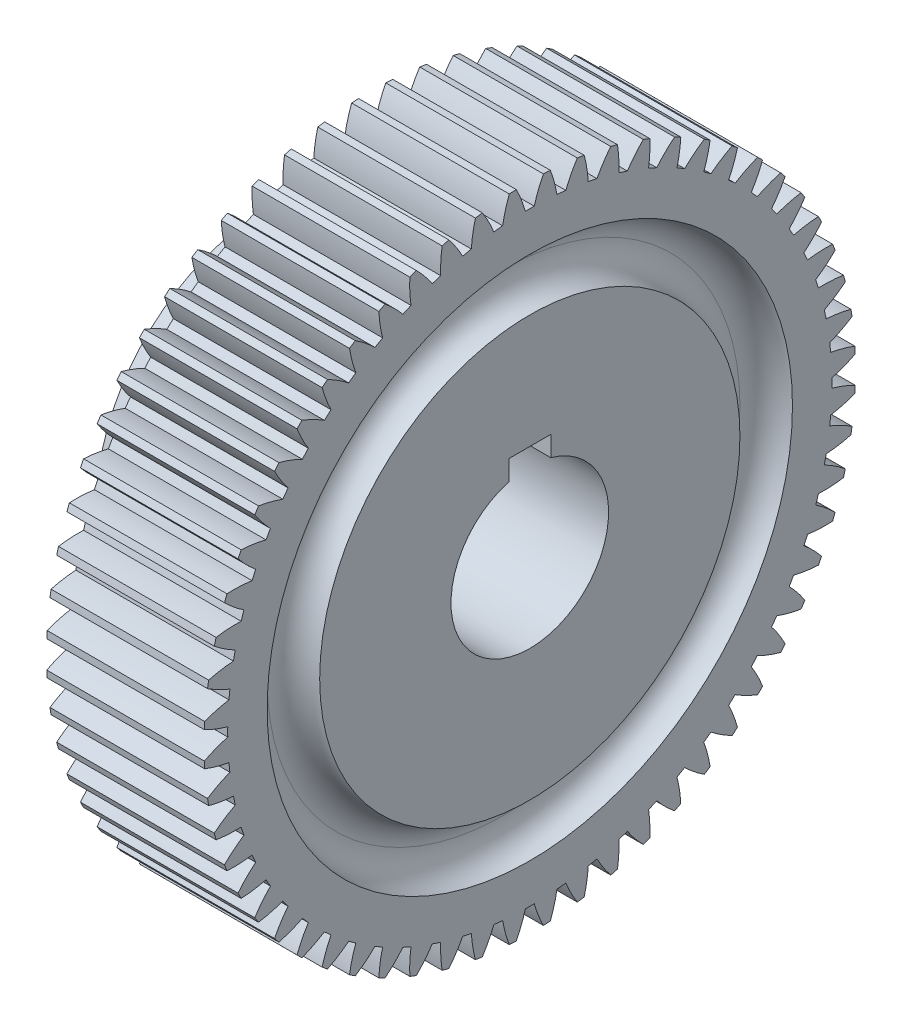
from build123d import *

# Parameters (mm, degrees)
FILLET1_START       = -9.108678671
FILLET1_DEPTH       = 30
FILLET1_START_2     = -29.108729471
FILLET1_2_OUTLINE_R = 32.5
FILLET1_2_DEPTH     = 20.0000508
SKETCH3_R           = 50
SKETCH3_R_2         = 40
CUT_EXTRUDE1_DEPTH  = 5
FILLET2_R           = 5
CUT_EXTRUDE2_START  = -5
SKETCH4_R           = 50
SKETCH4_R_2         = 40
CUT_EXTRUDE2_DEPTH  = 5
FILLET3_R           = 5


with BuildPart() as part:
    # Fillet1: read off the stored shape, not the designer's step
    # Fillet1 outline → Fillet1 (new body)
    with BuildSketch(Plane.YZ.offset(FILLET1_START)):
        with BuildLine():
            ThreePointArc((8.778409007, 60.022111997), (8.117564512, 60.060283888), (7.456350143, 60.091398166))
            ThreePointArc((7.456350143, 60.091398166), (6.476126837, 57.908102067), (5.718221378, 55.63803623))
            ThreePointArc((5.718221378, 55.63803623), (4.872735225, 55.644252733), (4.027249072, 55.63803623))
            ThreePointArc((4.027249072, 55.63803623), (3.269343613, 57.908102067), (2.289120307, 60.091398166))
            ThreePointArc((2.289120307, 60.091398166), (1.627905938, 60.060283888), (0.967061442, 60.022111997))
            ThreePointArc((0.967061442, 60.022111997), (0.220424489, 57.748314986), (-0.296042591, 55.411462115))
            ThreePointArc((-0.296042591, 55.411462115), (-1.137546885, 55.329267195), (-1.977751575, 55.234707378))
            ThreePointArc((-1.977751575, 55.234707378), (-2.968791642, 57.413114863), (-4.171861767, 59.481989403))
            ThreePointArc((-4.171861767, 59.481989403), (-4.826201608, 59.38192985), (-5.479435879, 59.274890009))
            ThreePointArc((-5.479435879, 59.274890009), (-5.984306169, 56.935504283), (-6.253676349, 54.557467426))
            ThreePointArc((-6.253676349, 54.557467426), (-7.081979085, 54.387761628), (-7.907696854, 54.205894514))
            ThreePointArc((-7.907696854, 54.205894514), (-9.121013487, 56.26877656), (-10.533749345, 58.200562517))
            ThreePointArc((-10.533749345, 58.200562517), (-11.174045572, 58.032653963), (-11.812512647, 57.857918923))
            ThreePointArc((-11.812512647, 57.857918923), (-12.07008481, 55.47857528), (-12.089406814, 53.085408707))
            ThreePointArc((-12.089406814, 53.085408707), (-12.895432935, 52.830051364), (-13.697617045, 52.562869528))
            ThreePointArc((-13.697617045, 52.562869528), (-15.119916892, 54.487624767), (-16.726840253, 56.26115709))
            ThreePointArc((-16.726840253, 56.26115709), (-17.346077647, 56.027239176), (-17.962782347, 55.78672337))
            ThreePointArc((-17.962782347, 55.78672337), (-17.970234369, 53.393490399), (-17.739296501, 51.011414144))
            ThreePointArc((-17.739296501, 51.011414144), (-18.514215015, 50.673203002), (-19.28407657, 50.323633744))
            ThreePointArc((-19.28407657, 50.323633744), (-20.899776618, 52.089174155), (-22.683281692, 53.685021653))
            ThreePointArc((-22.683281692, 53.685021653), (-23.274675759, 53.387657233), (-23.862861339, 53.083995803))
            ThreePointArc((-23.862861339, 53.083995803), (-23.620111573, 50.703094264), (-23.141444036, 48.358206852))
            ThreePointArc((-23.141444036, 48.358206852), (-23.876764775, 47.940847426), (-24.605869011, 47.512720699))
            ThreePointArc((-24.605869011, 47.512720699), (-26.39726731, 49.099702652), (-28.337813644, 50.500380886))
            ThreePointArc((-28.337813644, 50.500380886), (-28.894884946, 50.142827946), (-29.448107121, 49.779347871))
            ThreePointArc((-29.448107121, 49.779347871), (-28.957815185, 47.43686342), (-28.236662361, 45.154855928))
            ThreePointArc((-28.236662361, 45.154855928), (-28.924328997, 44.662920893), (-29.604687694, 44.160927344))
            ThreePointArc((-29.604687694, 44.160927344), (-31.552157311, 45.551963533), (-33.628483872, 46.742126378))
            ThreePointArc((-33.628483872, 46.742126378), (-34.14512902, 46.328302344), (-34.657326573, 45.908985986))
            ThreePointArc((-34.657326573, 45.908985986), (-33.924864207, 43.630583372), (-32.969127197, 41.436457953))
            ThreePointArc((-32.969127197, 41.436457953), (-33.60160551, 40.875337053), (-34.225764517, 40.304976629))
            ThreePointArc((-34.225764517, 40.304976629), (-36.307968567, 41.484826569), (-38.497326687, 42.451434353))
            ThreePointArc((-38.497326687, 42.451434353), (-38.967885209, 41.985873167), (-39.433446395, 41.515314645))
            ThreePointArc((-39.433446395, 41.515314645), (-38.466838611, 39.325956525), (-37.28698867, 37.243752475))
            ThreePointArc((-37.28698867, 37.243752475), (-37.857349095, 36.619593468), (-38.418469995, 35.987115156))
            ThreePointArc((-38.418469995, 35.987115156), (-40.612595414, 36.942852165), (-42.890998028, 37.675314531))
            ThreePointArc((-42.890998028, 37.675314531), (-43.310314385, 37.163116978), (-43.72413842, 36.64647183))
            ThreePointArc((-43.72413842, 36.64647183), (-42.533975574, 34.570145269), (-41.142939386, 32.622675652))
            ThreePointArc((-41.142939386, 32.622675652), (-41.644932935, 31.942316955), (-42.13686797, 31.254650319))
            ThreePointArc((-42.13686797, 31.254650319), (-44.418875461, 31.975803143), (-46.761359912, 32.46609508))
            ThreePointArc((-46.761359912, 32.46609508), (-47.124839988, 31.912872905), (-47.482392927, 31.355801602))
            ThreePointArc((-47.482392927, 31.355801602), (-46.081714694, 29.415255268), (-44.494732741, 27.623856969))
            ThreePointArc((-44.494732741, 27.623856969), (-44.922859467, 26.894752733), (-45.340218894, 26.159431994))
            ThreePointArc((-45.340218894, 26.159431994), (-47.685106306, 26.638099531), (-50.066007845, 26.880849297))
            ThreePointArc((-50.066007845, 26.880849297), (-50.369669275, 26.292663717), (-50.667033695, 25.701269651))
            ThreePointArc((-50.667033695, 25.701269651), (-49.071186197, 23.917764576), (-47.305645786, 22.302064529))
            ThreePointArc((-47.305645786, 22.302064529), (-47.655215044, 21.532202974), (-47.993426185, 20.757284459))
            ThreePointArc((-47.993426185, 20.757284459), (-50.375502441, 20.988222327), (-52.768735412, 20.980770306))
            ThreePointArc((-52.768735412, 20.980770306), (-53.009251218, 20.364065605), (-53.243169132, 19.744828211))
            ThreePointArc((-53.243169132, 19.744828211), (-51.469636809, 18.137904851), (-49.544881569, 16.715605003))
            ThreePointArc((-49.544881569, 16.715605003), (-49.812063406, 15.913420893), (-50.067420749, 15.107394772))
            ThreePointArc((-50.067420749, 15.107394772), (-52.460587322, 15.088072768), (-54.839930965, 14.830500605))
            ThreePointArc((-54.839930965, 14.830500605), (-55.014666005, 14.19203353), (-55.182574559, 13.551737303))
            ThreePointArc((-55.182574559, 13.551737303), (-53.250788602, 12.139001445), (-51.187906556, 10.925684812))
            ThreePointArc((-51.187906556, 10.925684812), (-51.36977367, 10.099967044), (-51.539479467, 9.271664308))
            ThreePointArc((-51.539479467, 9.271664308), (-53.917516324, 9.002294128), (-56.256902051, 8.497423837))
            ThreePointArc((-56.256902051, 8.497423837), (-56.363941892, 7.844189566), (-56.464001444, 7.189849726))
            ThreePointArc((-56.464001444, 7.189849726), (-54.395126905, 5.9867796), (-52.21671942, 4.995739533))
            ThreePointArc((-52.21671942, 4.995739533), (-52.311279237, 4.155534843), (-52.393474156, 3.314030549))
            ThreePointArc((-52.393474156, 3.314030549), (-54.730327027, 2.797563469), (-57.004124038, 2.050926516))
            ThreePointArc((-57.004124038, 2.050926516), (-57.04229593, 1.39008202), (-57.073410208, 0.728867651))
            ThreePointArc((-57.073410208, 0.728867651), (-54.890114108, -0.251355654), (-52.620048271, -1.009261113))
            ThreePointArc((-52.620048271, -1.009261113), (-52.626264775, -1.854747266), (-52.620048271, -2.70023342))
            ThreePointArc((-52.620048271, -2.70023342), (-54.890114108, -3.458138879), (-57.073410208, -4.438362184))
            ThreePointArc((-57.073410208, -4.438362184), (-57.04229593, -5.099576553), (-57.004124038, -5.760421049))
            ThreePointArc((-57.004124038, -5.760421049), (-54.730327027, -6.507058003), (-52.393474156, -7.023525083))
            ThreePointArc((-52.393474156, -7.023525083), (-52.311279237, -7.865029376), (-52.21671942, -8.705234066))
            ThreePointArc((-52.21671942, -8.705234066), (-54.395126905, -9.696274133), (-56.464001444, -10.899344259))
            ThreePointArc((-56.464001444, -10.899344259), (-56.363941892, -11.553684099), (-56.256902051, -12.20691837))
            ThreePointArc((-56.256902051, -12.20691837), (-53.917516324, -12.711788661), (-51.539479467, -12.981158841))
            ThreePointArc((-51.539479467, -12.981158841), (-51.36977367, -13.809461577), (-51.187906556, -14.635179346))
            ThreePointArc((-51.187906556, -14.635179346), (-53.250788602, -15.848495978), (-55.182574559, -17.261231836))
            ThreePointArc((-55.182574559, -17.261231836), (-55.014666005, -17.901528063), (-54.839930965, -18.539995138))
            ThreePointArc((-54.839930965, -18.539995138), (-52.460587323, -18.797567302), (-50.067420749, -18.816889305))
            ThreePointArc((-50.067420749, -18.816889305), (-49.812063406, -19.622915426), (-49.544881569, -20.425099537))
            ThreePointArc((-49.544881569, -20.425099537), (-51.469636809, -21.847399384), (-53.243169132, -23.454322744))
            ThreePointArc((-53.243169132, -23.454322744), (-53.009251218, -24.073560138), (-52.768735412, -24.690264839))
            ThreePointArc((-52.768735412, -24.690264839), (-50.375502441, -24.697716861), (-47.993426185, -24.466778992))
            ThreePointArc((-47.993426185, -24.466778992), (-47.655215044, -25.241697507), (-47.305645786, -26.011559062))
            ThreePointArc((-47.305645786, -26.011559062), (-49.071186197, -27.627259109), (-50.667033695, -29.410764184))
            ThreePointArc((-50.667033695, -29.410764184), (-50.369669275, -30.002158251), (-50.066007845, -30.590343831))
            ThreePointArc((-50.066007845, -30.590343831), (-47.685106306, -30.347594065), (-45.340218894, -29.868926527))
            ThreePointArc((-45.340218894, -29.868926527), (-44.922859467, -30.604247266), (-44.494732741, -31.333351502))
            ThreePointArc((-44.494732741, -31.333351502), (-46.081714694, -33.124749802), (-47.482392927, -35.065296135))
            ThreePointArc((-47.482392927, -35.065296135), (-47.124839988, -35.622367438), (-46.761359912, -36.175589613))
            ThreePointArc((-46.761359912, -36.175589613), (-44.418875461, -35.685297676), (-42.13686797, -34.964144852))
            ThreePointArc((-42.13686797, -34.964144852), (-41.644932935, -35.651811488), (-41.142939386, -36.332170186))
            ThreePointArc((-41.142939386, -36.332170186), (-42.533975574, -38.279639803), (-43.72413842, -40.355966364))
            ThreePointArc((-43.72413842, -40.355966364), (-43.310314385, -40.872611512), (-42.890998028, -41.384809064))
            ThreePointArc((-42.890998028, -41.384809064), (-40.612595414, -40.652346699), (-38.418469995, -39.696609689))
            ThreePointArc((-38.418469995, -39.696609689), (-37.857349095, -40.329088002), (-37.28698867, -40.953247009))
            ThreePointArc((-37.28698867, -40.953247009), (-38.466838611, -43.035451058), (-39.433446395, -45.224809179))
            ThreePointArc((-39.433446395, -45.224809179), (-38.967885209, -45.695367701), (-38.497326687, -46.160928887))
            ThreePointArc((-38.497326687, -46.160928887), (-36.307968567, -45.194321102), (-34.225764517, -44.014471162))
            ThreePointArc((-34.225764517, -44.014471162), (-33.60160551, -44.584831587), (-32.969127197, -45.145952487))
            ThreePointArc((-32.969127197, -45.145952487), (-33.924864207, -47.340077906), (-34.657326573, -49.61848052))
            ThreePointArc((-34.657326573, -49.61848052), (-34.14512902, -50.037796877), (-33.628483872, -50.451620911))
            ThreePointArc((-33.628483872, -50.451620911), (-31.552157311, -49.261458066), (-29.604687694, -47.870421877))
            ThreePointArc((-29.604687694, -47.870421877), (-28.924328997, -48.372415426), (-28.236662361, -48.864350461))
            ThreePointArc((-28.236662361, -48.864350461), (-28.957815185, -51.146357953), (-29.448107121, -53.488842404))
            ThreePointArc((-29.448107121, -53.488842404), (-28.894884946, -53.852322479), (-28.337813644, -54.209875419))
            ThreePointArc((-28.337813644, -54.209875419), (-26.39726731, -52.809197185), (-24.605869011, -51.222215232))
            ThreePointArc((-24.605869011, -51.222215232), (-23.876764775, -51.650341959), (-23.141444036, -52.067701385))
            ThreePointArc((-23.141444036, -52.067701385), (-23.620111573, -54.412588798), (-23.862861339, -56.793490337))
            ThreePointArc((-23.862861339, -56.793490337), (-23.274675759, -57.097151766), (-22.683281692, -57.394516186))
            ThreePointArc((-22.683281692, -57.394516186), (-20.899776617, -55.798668688), (-19.28407657, -54.033128277))
            ThreePointArc((-19.28407657, -54.033128277), (-18.514215015, -54.382697536), (-17.739296501, -54.720908677))
            ThreePointArc((-17.739296501, -54.720908677), (-17.970234369, -57.102984933), (-17.962782347, -59.496217904))
            ThreePointArc((-17.962782347, -59.496217904), (-17.346077647, -59.736733709), (-16.726840253, -59.970651623))
            ThreePointArc((-16.726840253, -59.970651623), (-15.119916892, -58.1971193), (-13.697617045, -56.272364061))
            ThreePointArc((-13.697617045, -56.272364061), (-12.895432935, -56.539545897), (-12.089406814, -56.794903241))
            ThreePointArc((-12.089406814, -56.794903241), (-12.07008481, -59.188069814), (-11.812512647, -61.567413456))
            ThreePointArc((-11.812512647, -61.567413456), (-11.174045572, -61.742148497), (-10.533749345, -61.91005705))
            ThreePointArc((-10.533749345, -61.91005705), (-9.121013487, -59.978271093), (-7.907696854, -57.915389047))
            ThreePointArc((-7.907696854, -57.915389047), (-7.081979085, -58.097256161), (-6.253676349, -58.266961959))
            ThreePointArc((-6.253676349, -58.266961959), (-5.984306169, -60.644998816), (-5.479435879, -62.984384542))
            ThreePointArc((-5.479435879, -62.984384542), (-4.826201608, -63.091424384), (-4.171861767, -63.191483936))
            ThreePointArc((-4.171861767, -63.191483936), (-2.968791642, -61.122609396), (-1.977751575, -58.944201911))
            ThreePointArc((-1.977751575, -58.944201911), (-1.137546885, -59.038761728), (-0.296042591, -59.120956648))
            ThreePointArc((-0.296042591, -59.120956648), (0.220424489, -61.457809519), (0.967061442, -63.73160653))
            ThreePointArc((0.967061442, -63.73160653), (1.627905938, -63.769778421), (2.289120307, -63.800892699))
            ThreePointArc((2.289120307, -63.800892699), (3.269343613, -61.6175966), (4.027249072, -59.347530763))
            ThreePointArc((4.027249072, -59.347530763), (4.872735225, -59.353747267), (5.718221378, -59.347530763))
            ThreePointArc((5.718221378, -59.347530763), (6.476126837, -61.6175966), (7.456350143, -63.800892699))
            ThreePointArc((7.456350143, -63.800892699), (8.117564512, -63.769778421), (8.778409007, -63.73160653))
            ThreePointArc((8.778409007, -63.73160653), (9.525045961, -61.457809519), (10.041513041, -59.120956648))
            ThreePointArc((10.041513041, -59.120956648), (10.883017335, -59.038761728), (11.723222025, -58.944201911))
            ThreePointArc((11.723222025, -58.944201911), (12.714262092, -61.122609396), (13.917332217, -63.191483936))
            ThreePointArc((13.917332217, -63.191483936), (14.571672057, -63.091424384), (15.224906328, -62.984384542))
            ThreePointArc((15.224906328, -62.984384542), (15.729776619, -60.644998816), (15.999146799, -58.266961959))
            ThreePointArc((15.999146799, -58.266961959), (16.827449535, -58.097256161), (17.653167304, -57.915389047))
            ThreePointArc((17.653167304, -57.915389047), (18.866483937, -59.978271093), (20.279219795, -61.91005705))
            ThreePointArc((20.279219795, -61.91005705), (20.919516021, -61.742148497), (21.557983096, -61.567413456))
            ThreePointArc((21.557983096, -61.567413456), (21.81555526, -59.188069814), (21.834877264, -56.794903241))
            ThreePointArc((21.834877264, -56.794903241), (22.640903385, -56.539545897), (23.443087495, -56.272364061))
            ThreePointArc((23.443087495, -56.272364061), (24.865387342, -58.1971193), (26.472310703, -59.970651623))
            ThreePointArc((26.472310703, -59.970651623), (27.091548097, -59.736733709), (27.708252797, -59.496217904))
            ThreePointArc((27.708252797, -59.496217904), (27.715704819, -57.102984933), (27.48476695, -54.720908677))
            ThreePointArc((27.48476695, -54.720908677), (28.259685465, -54.382697536), (29.02954702, -54.033128277))
            ThreePointArc((29.02954702, -54.033128277), (30.645247067, -55.798668688), (32.428752142, -57.394516186))
            ThreePointArc((32.428752142, -57.394516186), (33.020146209, -57.097151766), (33.608331789, -56.793490337))
            ThreePointArc((33.608331789, -56.793490337), (33.365582023, -54.412588798), (32.886914486, -52.067701385))
            ThreePointArc((32.886914486, -52.067701385), (33.622235225, -51.650341959), (34.35133946, -51.222215232))
            ThreePointArc((34.35133946, -51.222215232), (36.14273776, -52.809197185), (38.083284094, -54.209875419))
            ThreePointArc((38.083284094, -54.209875419), (38.640355396, -53.852322479), (39.193577571, -53.488842404))
            ThreePointArc((39.193577571, -53.488842404), (38.703285635, -51.146357953), (37.982132811, -48.864350461))
            ThreePointArc((37.982132811, -48.864350461), (38.669799446, -48.372415426), (39.350158144, -47.870421877))
            ThreePointArc((39.350158144, -47.870421877), (41.297627761, -49.261458066), (43.373954322, -50.451620911))
            ThreePointArc((43.373954322, -50.451620911), (43.89059947, -50.037796877), (44.402797023, -49.61848052))
            ThreePointArc((44.402797023, -49.61848052), (43.670334657, -47.340077906), (42.714597647, -45.145952487))
            ThreePointArc((42.714597647, -45.145952487), (43.34707596, -44.584831587), (43.971234967, -44.014471162))
            ThreePointArc((43.971234967, -44.014471162), (46.053439017, -45.194321102), (48.242797137, -46.160928887))
            ThreePointArc((48.242797137, -46.160928887), (48.713355658, -45.6953677), (49.178916845, -45.224809179))
            ThreePointArc((49.178916845, -45.224809179), (48.212309061, -43.035451058), (47.03245912, -40.953247009))
            ThreePointArc((47.03245912, -40.953247009), (47.602819545, -40.329088002), (48.163940445, -39.696609689))
            ThreePointArc((48.163940445, -39.696609689), (50.358065864, -40.652346699), (52.636468478, -41.384809064))
            ThreePointArc((52.636468478, -41.384809064), (53.055784835, -40.872611512), (53.46960887, -40.355966364))
            ThreePointArc((53.46960887, -40.355966364), (52.279446024, -38.279639803), (50.888409835, -36.332170186))
            ThreePointArc((50.888409835, -36.332170186), (51.390403384, -35.651811488), (51.882338419, -34.964144852))
            ThreePointArc((51.882338419, -34.964144852), (54.164345911, -35.685297676), (56.506830362, -36.175589613))
            ThreePointArc((56.506830362, -36.175589613), (56.870310438, -35.622367438), (57.227863377, -35.065296135))
            ThreePointArc((57.227863377, -35.065296135), (55.827185143, -33.124749801), (54.24020319, -31.333351502))
            ThreePointArc((54.24020319, -31.333351502), (54.668329917, -30.604247266), (55.085689344, -29.868926527))
            ThreePointArc((55.085689344, -29.868926527), (57.430576756, -30.347594065), (59.811478295, -30.590343831))
            ThreePointArc((59.811478295, -30.590343831), (60.115139725, -30.002158251), (60.412504145, -29.410764184))
            ThreePointArc((60.412504145, -29.410764184), (58.816656647, -27.627259109), (57.051116236, -26.011559062))
            ThreePointArc((57.051116236, -26.011559062), (57.400685494, -25.241697507), (57.738896635, -24.466778992))
            ThreePointArc((57.738896635, -24.466778992), (60.120972891, -24.697716861), (62.514205862, -24.690264839))
            ThreePointArc((62.514205862, -24.690264839), (62.754721668, -24.073560138), (62.988639581, -23.454322744))
            ThreePointArc((62.988639581, -23.454322744), (61.215107258, -21.847399384), (59.290352019, -20.425099537))
            ThreePointArc((59.290352019, -20.425099537), (59.557533855, -19.622915426), (59.812891199, -18.816889305))
            ThreePointArc((59.812891199, -18.816889305), (62.206057772, -18.797567302), (64.585401414, -18.539995138))
            ThreePointArc((64.585401414, -18.539995138), (64.760136455, -17.901528063), (64.928045009, -17.261231836))
            ThreePointArc((64.928045009, -17.261231836), (62.996259052, -15.848495978), (60.933377006, -14.635179346))
            ThreePointArc((60.933377006, -14.635179346), (61.11524412, -13.809461577), (61.284949917, -12.981158841))
            ThreePointArc((61.284949917, -12.981158841), (63.662986774, -12.711788661), (66.002372501, -12.20691837))
            ThreePointArc((66.002372501, -12.20691837), (66.109412342, -11.553684099), (66.209471894, -10.899344259))
            ThreePointArc((66.209471894, -10.899344259), (64.140597355, -9.696274133), (61.962189869, -8.705234066))
            ThreePointArc((61.962189869, -8.705234066), (62.056749687, -7.865029376), (62.138944606, -7.023525083))
            ThreePointArc((62.138944606, -7.023525083), (64.475797477, -6.507058003), (66.749594488, -5.760421049))
            ThreePointArc((66.749594488, -5.760421049), (66.78776638, -5.099576553), (66.818880658, -4.438362184))
            ThreePointArc((66.818880658, -4.438362184), (64.635584558, -3.458138879), (62.365518721, -2.70023342))
            ThreePointArc((62.365518721, -2.70023342), (62.371735225, -1.854747266), (62.365518721, -1.009261113))
            ThreePointArc((62.365518721, -1.009261113), (64.635584558, -0.251355654), (66.818880658, 0.728867651))
            ThreePointArc((66.818880658, 0.728867651), (66.78776638, 1.39008202), (66.749594488, 2.050926516))
            ThreePointArc((66.749594488, 2.050926516), (64.475797477, 2.797563469), (62.138944606, 3.314030549))
            ThreePointArc((62.138944606, 3.314030549), (62.056749687, 4.155534843), (61.962189869, 4.995739533))
            ThreePointArc((61.962189869, 4.995739533), (64.140597355, 5.9867796), (66.209471894, 7.189849726))
            ThreePointArc((66.209471894, 7.189849726), (66.109412342, 7.844189566), (66.002372501, 8.497423837))
            ThreePointArc((66.002372501, 8.497423837), (63.662986774, 9.002294128), (61.284949917, 9.271664308))
            ThreePointArc((61.284949917, 9.271664308), (61.11524412, 10.099967044), (60.933377006, 10.925684812))
            ThreePointArc((60.933377006, 10.925684812), (62.996259052, 12.139001445), (64.928045009, 13.551737303))
            ThreePointArc((64.928045009, 13.551737303), (64.760136455, 14.19203353), (64.585401414, 14.830500605))
            ThreePointArc((64.585401414, 14.830500605), (62.206057772, 15.088072768), (59.812891199, 15.107394772))
            ThreePointArc((59.812891199, 15.107394772), (59.557533855, 15.913420893), (59.290352019, 16.715605003))
            ThreePointArc((59.290352019, 16.715605003), (61.215107258, 18.13790485), (62.988639581, 19.744828211))
            ThreePointArc((62.988639581, 19.744828211), (62.754721668, 20.364065605), (62.514205862, 20.980770306))
            ThreePointArc((62.514205862, 20.980770306), (60.120972891, 20.988222327), (57.738896635, 20.757284459))
            ThreePointArc((57.738896635, 20.757284459), (57.400685494, 21.532202974), (57.051116236, 22.302064529))
            ThreePointArc((57.051116236, 22.302064529), (58.816656647, 23.917764576), (60.412504145, 25.701269651))
            ThreePointArc((60.412504145, 25.701269651), (60.115139725, 26.292663717), (59.811478295, 26.880849297))
            ThreePointArc((59.811478295, 26.880849297), (57.430576756, 26.638099531), (55.085689344, 26.159431994))
            ThreePointArc((55.085689344, 26.159431994), (54.668329917, 26.894752733), (54.24020319, 27.623856969))
            ThreePointArc((54.24020319, 27.623856969), (55.827185144, 29.415255268), (57.227863377, 31.355801602))
            ThreePointArc((57.227863377, 31.355801602), (56.870310438, 31.912872905), (56.506830362, 32.46609508))
            ThreePointArc((56.506830362, 32.46609508), (54.164345911, 31.975803143), (51.882338419, 31.254650319))
            ThreePointArc((51.882338419, 31.254650319), (51.390403384, 31.942316955), (50.888409835, 32.622675652))
            ThreePointArc((50.888409835, 32.622675652), (52.279446024, 34.570145269), (53.46960887, 36.64647183))
            ThreePointArc((53.46960887, 36.64647183), (53.055784835, 37.163116978), (52.636468478, 37.675314531))
            ThreePointArc((52.636468478, 37.675314531), (50.358065864, 36.942852165), (48.163940445, 35.987115156))
            ThreePointArc((48.163940445, 35.987115156), (47.602819545, 36.619593468), (47.03245912, 37.243752475))
            ThreePointArc((47.03245912, 37.243752475), (48.212309061, 39.325956525), (49.178916845, 41.515314645))
            ThreePointArc((49.178916845, 41.515314645), (48.713355659, 41.985873166), (48.242797137, 42.451434353))
            ThreePointArc((48.242797137, 42.451434353), (46.053439017, 41.484826569), (43.971234967, 40.304976629))
            ThreePointArc((43.971234967, 40.304976629), (43.34707596, 40.875337053), (42.714597647, 41.436457953))
            ThreePointArc((42.714597647, 41.436457953), (43.670334657, 43.630583372), (44.402797023, 45.908985986))
            ThreePointArc((44.402797023, 45.908985986), (43.89059947, 46.328302344), (43.373954322, 46.742126378))
            ThreePointArc((43.373954322, 46.742126378), (41.297627761, 45.551963533), (39.350158144, 44.160927344))
            ThreePointArc((39.350158144, 44.160927344), (38.669799446, 44.662920893), (37.982132811, 45.154855928))
            ThreePointArc((37.982132811, 45.154855928), (38.703285635, 47.43686342), (39.193577571, 49.779347871))
            ThreePointArc((39.193577571, 49.779347871), (38.640355396, 50.142827946), (38.083284094, 50.500380886))
            ThreePointArc((38.083284094, 50.500380886), (36.14273776, 49.099702652), (34.35133946, 47.512720699))
            ThreePointArc((34.35133946, 47.512720699), (33.622235225, 47.940847426), (32.886914486, 48.358206852))
            ThreePointArc((32.886914486, 48.358206852), (33.365582023, 50.703094264), (33.608331789, 53.083995803))
            ThreePointArc((33.608331789, 53.083995803), (33.020146209, 53.387657233), (32.428752142, 53.685021653))
            ThreePointArc((32.428752142, 53.685021653), (30.645247068, 52.089174155), (29.02954702, 50.323633744))
            ThreePointArc((29.02954702, 50.323633744), (28.259685465, 50.673203002), (27.48476695, 51.011414144))
            ThreePointArc((27.48476695, 51.011414144), (27.715704819, 53.393490399), (27.708252797, 55.78672337))
            ThreePointArc((27.708252797, 55.78672337), (27.091548097, 56.027239176), (26.472310703, 56.26115709))
            ThreePointArc((26.472310703, 56.26115709), (24.865387342, 54.487624767), (23.443087495, 52.562869528))
            ThreePointArc((23.443087495, 52.562869528), (22.640903385, 52.830051364), (21.834877264, 53.085408707))
            ThreePointArc((21.834877264, 53.085408707), (21.81555526, 55.478575281), (21.557983096, 57.857918923))
            ThreePointArc((21.557983096, 57.857918923), (20.919516021, 58.032653963), (20.279219794, 58.200562517))
            ThreePointArc((20.279219794, 58.200562517), (18.866483937, 56.26877656), (17.653167304, 54.205894514))
            ThreePointArc((17.653167304, 54.205894514), (16.827449535, 54.387761628), (15.999146799, 54.557467426))
            ThreePointArc((15.999146799, 54.557467426), (15.729776619, 56.935504283), (15.224906328, 59.274890009))
            ThreePointArc((15.224906328, 59.274890009), (14.571672057, 59.38192985), (13.917332217, 59.481989403))
            ThreePointArc((13.917332217, 59.481989403), (12.714262092, 57.413114863), (11.723222025, 55.234707378))
            ThreePointArc((11.723222025, 55.234707378), (10.883017335, 55.329267195), (10.041513041, 55.411462115))
            ThreePointArc((10.041513041, 55.411462115), (9.525045961, 57.748314986), (8.778409007, 60.022111997))
        make_face()
        with BuildLine():
            ThreePointArc((19.32956752, -5.854747267), (-10.127264775, -1.854747267), (19.32956752, 2.145252733))
            Line((19.32956752, 2.145252733), (23.172735225, 2.145252733))
            Line((23.172735225, 2.145252733), (23.172735225, -5.854747267))
            Line((23.172735225, -5.854747267), (19.32956752, -5.854747267))
        make_face(mode=Mode.SUBTRACT)
    extrude(amount=FILLET1_DEPTH)

    # Fillet1 2 outline → Fillet1 2 (add)
    with BuildSketch(Plane.YZ.offset(FILLET1_START_2)):
        with Locations((4.872735225, -1.854747267)):
            Circle(FILLET1_2_OUTLINE_R)
        with BuildLine():
            Line((23.172735225, -5.854747267), (19.32956752, -5.854747267))
            ThreePointArc((19.32956752, -5.854747267), (-10.127264775, -1.854747267), (19.32956752, 2.145252733))
            Line((19.32956752, 2.145252733), (23.172735225, 2.145252733))
            Line((23.172735225, 2.145252733), (23.172735225, -5.854747267))
        make_face(mode=Mode.SUBTRACT)
    extrude(amount=FILLET1_2_DEPTH)

    # Fillet1 3 outline → Fillet1 3 (revolve)
    with BuildSketch(Plane(origin=(0, 4.872735225, -1.854747267), x_dir=(0, 1, 0), z_dir=(0, 0, -1))):
        with BuildLine():
            ThreePointArc((32.5, -12.108678671), (33.378679656, -9.987358327), (35.5, -9.108678671))
            Line((35.5, -9.108678671), (32.5, -9.108678671))
            Line((32.5, -9.108678671), (32.5, -12.108678671))
        make_face()
    revolve(axis=Axis((0, 4.872735225, -1.854747267), (1, 0, 0)))

    # Sketch3 → Cut-Extrude1 (cut)
    with BuildSketch(Plane(origin=(20.891321329, 0, 0), x_dir=(0, 0, -1), z_dir=(1, 0, 0))):
        with Locations((1.854747267, 4.872735225)):
            Circle(SKETCH3_R)
        with Locations((1.854747267, 4.872735225)):
            Circle(SKETCH3_R_2, mode=Mode.SUBTRACT)
    extrude(amount=-CUT_EXTRUDE1_DEPTH, mode=Mode.SUBTRACT)

    # Fillet2
    fillet2_edges = [part.edges().sort_by_distance(p)[0] for p in [
        (15.891321329, 4.872735225, 48.145252733),
        (15.891321329, 4.872735225, 38.145252733),
    ]]
    fillet(fillet2_edges, radius=FILLET2_R - 0.0001)  # a hair under: the kernel refuses the full size

    # Sketch4 → Cut-Extrude2 (cut)
    with BuildSketch(Plane.ZY.offset(9.108678671).offset(CUT_EXTRUDE2_START)):
        with Locations((-1.854747267, 4.872735225)):
            Circle(SKETCH4_R)
        with Locations((-1.854747267, 4.872735225)):
            Circle(SKETCH4_R_2, mode=Mode.SUBTRACT)
    extrude(amount=CUT_EXTRUDE2_DEPTH, mode=Mode.SUBTRACT)

    # Fillet3
    fillet3_edges = [part.edges().sort_by_distance(p)[0] for p in [
        (-4.108678671, 4.872735225, -51.854747267),
        (-4.108678671, 4.872735225, -41.854747267),
    ]]
    fillet(fillet3_edges, radius=FILLET3_R - 0.0001)  # a hair under: the kernel refuses the full size


solid = part.part
